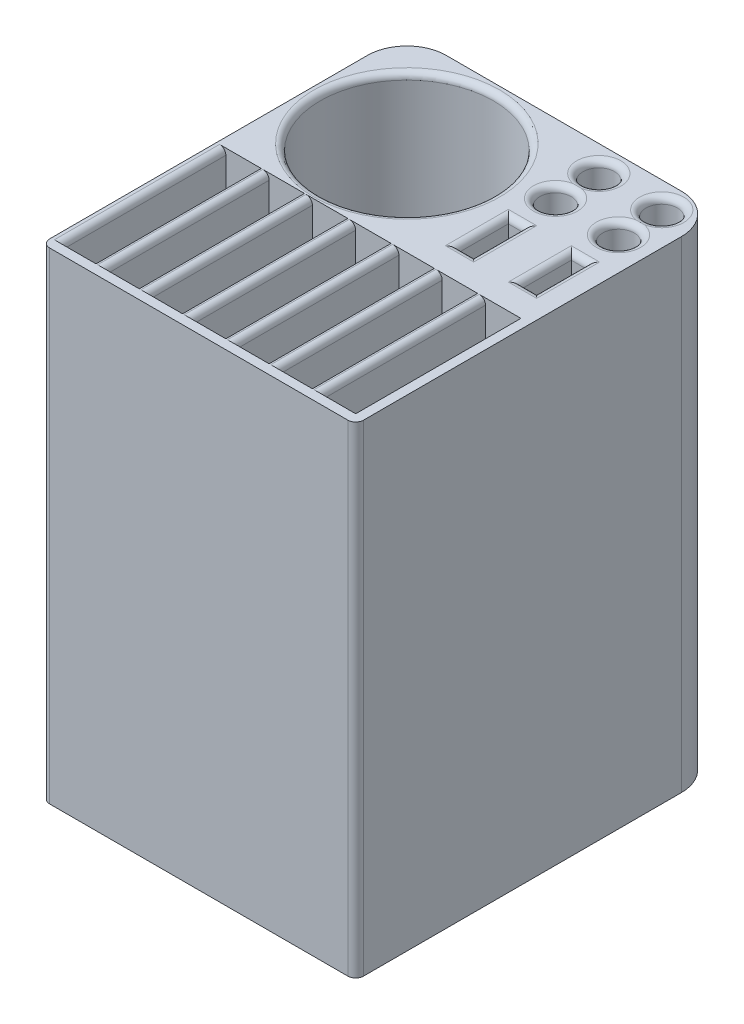
from build123d import *

# Parameters (mm, degrees)
SKETCH_1_W      = 39.9
SKETCH_1_H      = 46.4
SKETCH_1_R      = 11
SKETCH_1_R_2    = 2
SKETCH_1_W_2    = 4.5
SKETCH_1_H_2    = 21
SKETCH_1_W_3    = 2
SKETCH_1_H_3    = 6.4
EXTRUDE_1_DEPTH = 60
SKETCH_2_W      = 39.9
SKETCH_2_H      = 46.4
EXTRUDE_2_DEPTH = 1.2
FILLET_1_R      = 1
FILLET_2_R      = 5
FILLET_3_R      = 0.8


with BuildPart() as part:
    # 草图1 → 凸台-拉伸1 (new body)
    with BuildSketch(Plane(origin=(0, 0, 0), x_dir=(1, 0, 0), z_dir=(0, 1, 0))):
        with Locations((16.5, 11.5)):
            Rectangle(SKETCH_1_W, SKETCH_1_H)
        with Locations(Location((8.75, 22.5, 0), (0, 0, 270))):
            Circle(SKETCH_1_R, mode=Mode.SUBTRACT)
        with Locations(Location((24.25, 25.9, 0), (0, 0, 270))):
            Circle(SKETCH_1_R_2, mode=Mode.SUBTRACT)
        with Locations(Location((32.25, 25.9, 0), (0, 0, 270))):
            Circle(SKETCH_1_R_2, mode=Mode.SUBTRACT)
        with Locations(Location((24.25, 31.4, 0), (0, 0, 270))):
            Circle(SKETCH_1_R_2, mode=Mode.SUBTRACT)
        with Locations(Location((32.25, 31.4, 0), (0, 0, 270))):
            Circle(SKETCH_1_R_2, mode=Mode.SUBTRACT)
        with Locations((5.5, 0)):
            Rectangle(SKETCH_1_W_2, SKETCH_1_H_2, mode=Mode.SUBTRACT)
        Rectangle(SKETCH_1_W_2, SKETCH_1_H_2, mode=Mode.SUBTRACT)
        with Locations((11, 0)):
            Rectangle(SKETCH_1_W_2, SKETCH_1_H_2, mode=Mode.SUBTRACT)
        with Locations((16.5, 0)):
            Rectangle(SKETCH_1_W_2, SKETCH_1_H_2, mode=Mode.SUBTRACT)
        with Locations((22, 0)):
            Rectangle(SKETCH_1_W_2, SKETCH_1_H_2, mode=Mode.SUBTRACT)
        with Locations((27.5, 0)):
            Rectangle(SKETCH_1_W_2, SKETCH_1_H_2, mode=Mode.SUBTRACT)
        with Locations((24.25, 17.7)):
            Rectangle(SKETCH_1_W_3, SKETCH_1_H_3, mode=Mode.SUBTRACT)
        with Locations((33, 0)):
            Rectangle(SKETCH_1_W_2, SKETCH_1_H_2, mode=Mode.SUBTRACT)
        with Locations((32.25, 17.7)):
            Rectangle(SKETCH_1_W_3, SKETCH_1_H_3, mode=Mode.SUBTRACT)
    extrude(amount=EXTRUDE_1_DEPTH)

    # 草图2 → 凸台-拉伸2 (add)
    with BuildSketch(Plane.XZ):
        with Locations((16.5, -11.5)):
            Rectangle(SKETCH_2_W, SKETCH_2_H)
    extrude(amount=EXTRUDE_2_DEPTH)

    # 圆角1
    fillet_1_edges = [part.edges().sort_by_distance(p)[0] for p in [
        (36.45, 29.4, 11.7),
        (-3.45, 29.4, 11.7),
    ]]
    fillet(fillet_1_edges, radius=FILLET_1_R)

    # 圆角2
    fillet_2_edges = [part.edges().sort_by_distance(p)[0] for p in [
        (-3.45, 29.4, -34.7),
        (36.45, 29.4, -34.7),
    ]]
    fillet(fillet_2_edges, radius=FILLET_2_R)

    # 圆角3
    # the kernel refuses this fillet: 0.8 mm, written as the material it takes off along each edge
    with BuildSketch(Plane(origin=(31.25, 60, -14.5), x_dir=(-1, 0, 0), z_dir=(0, 0, -1)), Plane(origin=(33.25, 60, -20.9), x_dir=(1, 0, 0), z_dir=(0, 0, 1)), Plane(origin=(23.25, 60, -14.5), x_dir=(-1, 0, 0), z_dir=(0, 0, -1)), Plane(origin=(25.25, 60, -20.9), x_dir=(1, 0, 0), z_dir=(0, 0, 1))) as fillet_3_piece_1:
        with BuildLine():
            CenterArc((FILLET_3_R, -FILLET_3_R), FILLET_3_R, 90, 90)
            Line((0, -FILLET_3_R), (0, 0))
            Line((0, 0), (FILLET_3_R, 0))
        make_face()
    extrude(amount=6.4, mode=Mode.SUBTRACT)
    with BuildSketch(Plane(origin=(33.25, 60, -14.5), x_dir=(0, 0, 1), z_dir=(-1, 0, 0)), Plane(origin=(31.25, 60, -20.9), x_dir=(0, 0, -1), z_dir=(1, 0, 0)), Plane(origin=(25.25, 60, -14.5), x_dir=(0, 0, 1), z_dir=(-1, 0, 0)), Plane(origin=(23.25, 60, -20.9), x_dir=(0, 0, -1), z_dir=(1, 0, 0))) as fillet_3_piece_2:
        with BuildLine():
            CenterArc((FILLET_3_R, -FILLET_3_R), FILLET_3_R, 90, 90)
            Line((0, -FILLET_3_R), (0, 0))
            Line((0, 0), (FILLET_3_R, 0))
        make_face()
    extrude(amount=2, mode=Mode.SUBTRACT)
    with BuildSketch(Plane(origin=(24.25, 60, -25.9), x_dir=(0, 0, 1), z_dir=(-1, 0, 0))) as fillet_3_piece_3:
        with BuildLine():
            CenterArc((2 + FILLET_3_R, -FILLET_3_R), FILLET_3_R, 90, 90)
            Line((2, -FILLET_3_R), (2, 0))
            Line((2, 0), (2 + FILLET_3_R, 0))
        make_face()
    revolve(axis=Axis((24.25, 60, -25.9), (0, 1, 0)), mode=Mode.SUBTRACT)
    with BuildSketch(Plane(origin=(32.25, 60, -25.9), x_dir=(0, 0, 1), z_dir=(-1, 0, 0))) as fillet_3_piece_4:
        with BuildLine():
            CenterArc((2 + FILLET_3_R, -FILLET_3_R), FILLET_3_R, 90, 90)
            Line((2, -FILLET_3_R), (2, 0))
            Line((2, 0), (2 + FILLET_3_R, 0))
        make_face()
    revolve(axis=Axis((32.25, 60, -25.9), (0, 1, 0)), mode=Mode.SUBTRACT)
    with BuildSketch(Plane(origin=(30.75, 60, 10.5), x_dir=(-1, 0, 0), z_dir=(0, 0, -1)), Plane(origin=(-2.25, 60, 10.5), x_dir=(-1, 0, 0), z_dir=(0, 0, -1)), Plane(origin=(3.25, 60, 10.5), x_dir=(-1, 0, 0), z_dir=(0, 0, -1)), Plane(origin=(8.75, 60, 10.5), x_dir=(-1, 0, 0), z_dir=(0, 0, -1)), Plane(origin=(14.25, 60, 10.5), x_dir=(-1, 0, 0), z_dir=(0, 0, -1)), Plane(origin=(19.75, 60, 10.5), x_dir=(-1, 0, 0), z_dir=(0, 0, -1)), Plane(origin=(25.25, 60, 10.5), x_dir=(-1, 0, 0), z_dir=(0, 0, -1))) as fillet_3_piece_5:
        with BuildLine():
            CenterArc((FILLET_3_R, -FILLET_3_R), FILLET_3_R, 90, 90)
            Line((0, -FILLET_3_R), (0, 0))
            Line((0, 0), (FILLET_3_R, 0))
        make_face()
    extrude(amount=21, mode=Mode.SUBTRACT)
    with BuildSketch(Plane(origin=(24.25, 60, -31.4), x_dir=(0, 0, 1), z_dir=(-1, 0, 0))) as fillet_3_piece_6:
        with BuildLine():
            CenterArc((2 + FILLET_3_R, -FILLET_3_R), FILLET_3_R, 90, 90)
            Line((2, -FILLET_3_R), (2, 0))
            Line((2, 0), (2 + FILLET_3_R, 0))
        make_face()
    revolve(axis=Axis((24.25, 60, -31.4), (0, 1, 0)), mode=Mode.SUBTRACT)
    with BuildSketch(Plane(origin=(32.25, 60, -31.4), x_dir=(0, 0, 1), z_dir=(-1, 0, 0))) as fillet_3_piece_7:
        with BuildLine():
            CenterArc((2 + FILLET_3_R, -FILLET_3_R), FILLET_3_R, 90, 90)
            Line((2, -FILLET_3_R), (2, 0))
            Line((2, 0), (2 + FILLET_3_R, 0))
        make_face()
    revolve(axis=Axis((32.25, 60, -31.4), (0, 1, 0)), mode=Mode.SUBTRACT)
    with BuildSketch(Plane(origin=(8.75, 60, -22.5), x_dir=(0, 0, 1), z_dir=(-1, 0, 0))) as fillet_3_piece_8:
        with BuildLine():
            CenterArc((11 + FILLET_3_R, -FILLET_3_R), FILLET_3_R, 90, 90)
            Line((11, -FILLET_3_R), (11, 0))
            Line((11, 0), (11 + FILLET_3_R, 0))
        make_face()
    revolve(axis=Axis((8.75, 60, -22.5), (0, 1, 0)), mode=Mode.SUBTRACT)
    with BuildSketch(Plane(origin=(31.25, 60, -12.5), x_dir=(-1, 0, 0), z_dir=(0, 0, -1))) as fillet_3_piece_9a_section:
        with BuildLine():
            CenterArc((FILLET_3_R, -FILLET_3_R), FILLET_3_R, 90, 90)
            Line((0, -FILLET_3_R), (0, 0))
            Line((0, 0), (FILLET_3_R, 0))
        make_face()
    fillet_3_piece_9a = extrude(amount=8.4, mode=Mode.PRIVATE)
    fillet_3_piece_9a = split(fillet_3_piece_9a, bisect_by=Plane(origin=(31.068883909, 59.818883909, -14.5), z_dir=(0, 0, 1)), keep=Keep.TOP, mode=Mode.PRIVATE)
    with BuildSketch(Plane(origin=(33.25, 60, -14.5), x_dir=(0, 0, 1), z_dir=(-1, 0, 0))) as fillet_3_piece_9b_section:
        with BuildLine():
            CenterArc((FILLET_3_R, -FILLET_3_R), FILLET_3_R, 90, 90)
            Line((0, -FILLET_3_R), (0, 0))
            Line((0, 0), (FILLET_3_R, 0))
        make_face()
    fillet_3_piece_9b = extrude(amount=4, mode=Mode.PRIVATE)
    fillet_3_piece_9b = split(fillet_3_piece_9b, bisect_by=Plane(origin=(31.25, 59.818883909, -14.318883909), z_dir=(-1, 0, 0)), keep=Keep.TOP, mode=Mode.PRIVATE)
    fillet_3_piece_9 = fillet_3_piece_9a & fillet_3_piece_9b
    add(fillet_3_piece_9, mode=Mode.SUBTRACT)
    with BuildSketch(Plane(origin=(29.25, 60, -20.9), x_dir=(0, 0, -1), z_dir=(1, 0, 0))) as fillet_3_piece_10a_section:
        with BuildLine():
            CenterArc((FILLET_3_R, -FILLET_3_R), FILLET_3_R, 90, 90)
            Line((0, -FILLET_3_R), (0, 0))
            Line((0, 0), (FILLET_3_R, 0))
        make_face()
    fillet_3_piece_10a = extrude(amount=4, mode=Mode.PRIVATE)
    fillet_3_piece_10a = split(fillet_3_piece_10a, bisect_by=Plane(origin=(31.25, 59.818883909, -21.081116091), z_dir=(-1, 0, 0)), keep=Keep.TOP, mode=Mode.PRIVATE)
    with BuildSketch(Plane(origin=(31.25, 60, -14.5), x_dir=(-1, 0, 0), z_dir=(0, 0, -1))) as fillet_3_piece_10b_section:
        with BuildLine():
            CenterArc((FILLET_3_R, -FILLET_3_R), FILLET_3_R, 90, 90)
            Line((0, -FILLET_3_R), (0, 0))
            Line((0, 0), (FILLET_3_R, 0))
        make_face()
    fillet_3_piece_10b = extrude(amount=8.4, mode=Mode.PRIVATE)
    fillet_3_piece_10b = split(fillet_3_piece_10b, bisect_by=Plane(origin=(31.068883909, 59.818883909, -20.9), z_dir=(0, 0, -1)), keep=Keep.TOP, mode=Mode.PRIVATE)
    fillet_3_piece_10 = fillet_3_piece_10a & fillet_3_piece_10b
    add(fillet_3_piece_10, mode=Mode.SUBTRACT)
    with BuildSketch(Plane(origin=(35.25, 60, -14.5), x_dir=(0, 0, 1), z_dir=(-1, 0, 0))) as fillet_3_piece_11a_section:
        with BuildLine():
            CenterArc((FILLET_3_R, -FILLET_3_R), FILLET_3_R, 90, 90)
            Line((0, -FILLET_3_R), (0, 0))
            Line((0, 0), (FILLET_3_R, 0))
        make_face()
    fillet_3_piece_11a = extrude(amount=4, mode=Mode.PRIVATE)
    fillet_3_piece_11a = split(fillet_3_piece_11a, bisect_by=Plane(origin=(33.25, 59.818883909, -14.318883909), z_dir=(1, 0, 0)), keep=Keep.TOP, mode=Mode.PRIVATE)
    with BuildSketch(Plane(origin=(33.25, 60, -20.9), x_dir=(1, 0, 0), z_dir=(0, 0, 1))) as fillet_3_piece_11b_section:
        with BuildLine():
            CenterArc((FILLET_3_R, -FILLET_3_R), FILLET_3_R, 90, 90)
            Line((0, -FILLET_3_R), (0, 0))
            Line((0, 0), (FILLET_3_R, 0))
        make_face()
    fillet_3_piece_11b = extrude(amount=8.4, mode=Mode.PRIVATE)
    fillet_3_piece_11b = split(fillet_3_piece_11b, bisect_by=Plane(origin=(33.431116091, 59.818883909, -14.5), z_dir=(0, 0, 1)), keep=Keep.TOP, mode=Mode.PRIVATE)
    fillet_3_piece_11 = fillet_3_piece_11a & fillet_3_piece_11b
    add(fillet_3_piece_11, mode=Mode.SUBTRACT)
    with BuildSketch(Plane(origin=(31.25, 60, -20.9), x_dir=(0, 0, -1), z_dir=(1, 0, 0))) as fillet_3_piece_12a_section:
        with BuildLine():
            CenterArc((FILLET_3_R, -FILLET_3_R), FILLET_3_R, 90, 90)
            Line((0, -FILLET_3_R), (0, 0))
            Line((0, 0), (FILLET_3_R, 0))
        make_face()
    fillet_3_piece_12a = extrude(amount=4, mode=Mode.PRIVATE)
    fillet_3_piece_12a = split(fillet_3_piece_12a, bisect_by=Plane(origin=(33.25, 59.818883909, -21.081116091), z_dir=(1, 0, 0)), keep=Keep.TOP, mode=Mode.PRIVATE)
    with BuildSketch(Plane(origin=(33.25, 60, -22.9), x_dir=(1, 0, 0), z_dir=(0, 0, 1))) as fillet_3_piece_12b_section:
        with BuildLine():
            CenterArc((FILLET_3_R, -FILLET_3_R), FILLET_3_R, 90, 90)
            Line((0, -FILLET_3_R), (0, 0))
            Line((0, 0), (FILLET_3_R, 0))
        make_face()
    fillet_3_piece_12b = extrude(amount=8.4, mode=Mode.PRIVATE)
    fillet_3_piece_12b = split(fillet_3_piece_12b, bisect_by=Plane(origin=(33.431116091, 59.818883909, -20.9), z_dir=(0, 0, -1)), keep=Keep.TOP, mode=Mode.PRIVATE)
    fillet_3_piece_12 = fillet_3_piece_12a & fillet_3_piece_12b
    add(fillet_3_piece_12, mode=Mode.SUBTRACT)
    with BuildSketch(Plane(origin=(23.25, 60, -12.5), x_dir=(-1, 0, 0), z_dir=(0, 0, -1))) as fillet_3_piece_13a_section:
        with BuildLine():
            CenterArc((FILLET_3_R, -FILLET_3_R), FILLET_3_R, 90, 90)
            Line((0, -FILLET_3_R), (0, 0))
            Line((0, 0), (FILLET_3_R, 0))
        make_face()
    fillet_3_piece_13a = extrude(amount=8.4, mode=Mode.PRIVATE)
    fillet_3_piece_13a = split(fillet_3_piece_13a, bisect_by=Plane(origin=(23.068883909, 59.818883909, -14.5), z_dir=(0, 0, 1)), keep=Keep.TOP, mode=Mode.PRIVATE)
    with BuildSketch(Plane(origin=(25.25, 60, -14.5), x_dir=(0, 0, 1), z_dir=(-1, 0, 0))) as fillet_3_piece_13b_section:
        with BuildLine():
            CenterArc((FILLET_3_R, -FILLET_3_R), FILLET_3_R, 90, 90)
            Line((0, -FILLET_3_R), (0, 0))
            Line((0, 0), (FILLET_3_R, 0))
        make_face()
    fillet_3_piece_13b = extrude(amount=4, mode=Mode.PRIVATE)
    fillet_3_piece_13b = split(fillet_3_piece_13b, bisect_by=Plane(origin=(23.25, 59.818883909, -14.318883909), z_dir=(-1, 0, 0)), keep=Keep.TOP, mode=Mode.PRIVATE)
    fillet_3_piece_13 = fillet_3_piece_13a & fillet_3_piece_13b
    add(fillet_3_piece_13, mode=Mode.SUBTRACT)
    with BuildSketch(Plane(origin=(23.25, 60, -14.5), x_dir=(-1, 0, 0), z_dir=(0, 0, -1))) as fillet_3_piece_14a_section:
        with BuildLine():
            CenterArc((FILLET_3_R, -FILLET_3_R), FILLET_3_R, 90, 90)
            Line((0, -FILLET_3_R), (0, 0))
            Line((0, 0), (FILLET_3_R, 0))
        make_face()
    fillet_3_piece_14a = extrude(amount=8.4, mode=Mode.PRIVATE)
    fillet_3_piece_14a = split(fillet_3_piece_14a, bisect_by=Plane(origin=(23.068883909, 59.818883909, -20.9), z_dir=(0, 0, -1)), keep=Keep.TOP, mode=Mode.PRIVATE)
    with BuildSketch(Plane(origin=(21.25, 60, -20.9), x_dir=(0, 0, -1), z_dir=(1, 0, 0))) as fillet_3_piece_14b_section:
        with BuildLine():
            CenterArc((FILLET_3_R, -FILLET_3_R), FILLET_3_R, 90, 90)
            Line((0, -FILLET_3_R), (0, 0))
            Line((0, 0), (FILLET_3_R, 0))
        make_face()
    fillet_3_piece_14b = extrude(amount=4, mode=Mode.PRIVATE)
    fillet_3_piece_14b = split(fillet_3_piece_14b, bisect_by=Plane(origin=(23.25, 59.818883909, -21.081116091), z_dir=(-1, 0, 0)), keep=Keep.TOP, mode=Mode.PRIVATE)
    fillet_3_piece_14 = fillet_3_piece_14a & fillet_3_piece_14b
    add(fillet_3_piece_14, mode=Mode.SUBTRACT)
    with BuildSketch(Plane(origin=(27.25, 60, -14.5), x_dir=(0, 0, 1), z_dir=(-1, 0, 0))) as fillet_3_piece_15a_section:
        with BuildLine():
            CenterArc((FILLET_3_R, -FILLET_3_R), FILLET_3_R, 90, 90)
            Line((0, -FILLET_3_R), (0, 0))
            Line((0, 0), (FILLET_3_R, 0))
        make_face()
    fillet_3_piece_15a = extrude(amount=4, mode=Mode.PRIVATE)
    fillet_3_piece_15a = split(fillet_3_piece_15a, bisect_by=Plane(origin=(25.25, 59.818883909, -14.318883909), z_dir=(1, 0, 0)), keep=Keep.TOP, mode=Mode.PRIVATE)
    with BuildSketch(Plane(origin=(25.25, 60, -20.9), x_dir=(1, 0, 0), z_dir=(0, 0, 1))) as fillet_3_piece_15b_section:
        with BuildLine():
            CenterArc((FILLET_3_R, -FILLET_3_R), FILLET_3_R, 90, 90)
            Line((0, -FILLET_3_R), (0, 0))
            Line((0, 0), (FILLET_3_R, 0))
        make_face()
    fillet_3_piece_15b = extrude(amount=8.4, mode=Mode.PRIVATE)
    fillet_3_piece_15b = split(fillet_3_piece_15b, bisect_by=Plane(origin=(25.431116091, 59.818883909, -14.5), z_dir=(0, 0, 1)), keep=Keep.TOP, mode=Mode.PRIVATE)
    fillet_3_piece_15 = fillet_3_piece_15a & fillet_3_piece_15b
    add(fillet_3_piece_15, mode=Mode.SUBTRACT)
    with BuildSketch(Plane(origin=(25.25, 60, -22.9), x_dir=(1, 0, 0), z_dir=(0, 0, 1))) as fillet_3_piece_16a_section:
        with BuildLine():
            CenterArc((FILLET_3_R, -FILLET_3_R), FILLET_3_R, 90, 90)
            Line((0, -FILLET_3_R), (0, 0))
            Line((0, 0), (FILLET_3_R, 0))
        make_face()
    fillet_3_piece_16a = extrude(amount=8.4, mode=Mode.PRIVATE)
    fillet_3_piece_16a = split(fillet_3_piece_16a, bisect_by=Plane(origin=(25.431116091, 59.818883909, -20.9), z_dir=(0, 0, -1)), keep=Keep.TOP, mode=Mode.PRIVATE)
    with BuildSketch(Plane(origin=(23.25, 60, -20.9), x_dir=(0, 0, -1), z_dir=(1, 0, 0))) as fillet_3_piece_16b_section:
        with BuildLine():
            CenterArc((FILLET_3_R, -FILLET_3_R), FILLET_3_R, 90, 90)
            Line((0, -FILLET_3_R), (0, 0))
            Line((0, 0), (FILLET_3_R, 0))
        make_face()
    fillet_3_piece_16b = extrude(amount=4, mode=Mode.PRIVATE)
    fillet_3_piece_16b = split(fillet_3_piece_16b, bisect_by=Plane(origin=(25.25, 59.818883909, -21.081116091), z_dir=(1, 0, 0)), keep=Keep.TOP, mode=Mode.PRIVATE)
    fillet_3_piece_16 = fillet_3_piece_16a & fillet_3_piece_16b
    add(fillet_3_piece_16, mode=Mode.SUBTRACT)


solid = part.part
